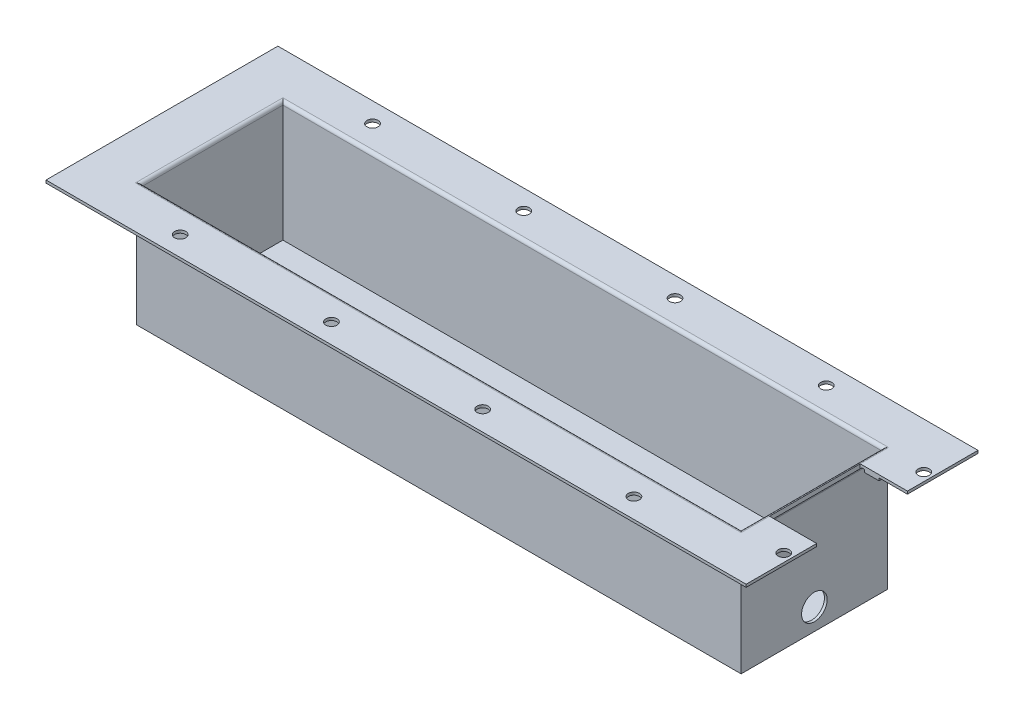
from build123d import *

# Parameters (mm, degrees)
SKETCH1_W               = 359.9
SKETCH1_H               = 87.2
BOSS_EXTRUDE1_DEPTH     = 1.6256
SKETCH2_W               = 359.9
SKETCH2_H               = 87.2
SKETCH2_W_2             = 356.6488
SKETCH2_H_2             = 83.9488
BOSS_EXTRUDE2_DEPTH     = 69.85
SKETCH3_W               = 416.6488
SKETCH3_H               = 138
SKETCH3_W_2             = 356.6488
SKETCH3_H_2             = 83.9488
BOSS_EXTRUDE3_DEPTH     = 1.6256
FILLET1_R               = 1.905
SKETCH6_W               = 371.0088
SKETCH6_H               = 92.8388
BOSS_EXTRUDE4_DEPTH     = 3.175
SKETCH8_R               = 7.62
CUT_EXTRUDE2_DEPTH      = 402.075797246
CUT_EXTRUDE4_DEPTH      = 232.308973187
CUT_EXTRUDE4_DEPTH_BACK = 232.308973187
SKETCH17_W              = 28.095
SKETCH17_H              = 54
CUT_EXTRUDE5_DEPTH      = 232.308973187
CUT_EXTRUDE5_DEPTH_BACK = 232.308973187
SKETCH18_R              = 3.325


with BuildPart() as part:
    # Sketch1 → Boss-Extrude1 (new body)
    with BuildSketch(Plane(origin=(0, 0, 0), x_dir=(1, 0, 0), z_dir=(0, 1, 0))):
        Rectangle(SKETCH1_W, SKETCH1_H)
    extrude(amount=BOSS_EXTRUDE1_DEPTH)

    # Sketch2 → Boss-Extrude2 (add)
    with BuildSketch(Plane(origin=(0, 1.6256, 0), x_dir=(1, 0, 0), z_dir=(0, 1, 0))):
        Rectangle(SKETCH2_W, SKETCH2_H)
        Rectangle(SKETCH2_W_2, SKETCH2_H_2, mode=Mode.SUBTRACT)
    extrude(amount=BOSS_EXTRUDE2_DEPTH)

    # Sketch3 → Boss-Extrude3 (add)
    with BuildSketch(Plane(origin=(0, 71.4756, 0), x_dir=(1, 0, 0), z_dir=(0, 1, 0))):
        Rectangle(SKETCH3_W, SKETCH3_H)
        Rectangle(SKETCH3_W_2, SKETCH3_H_2, mode=Mode.SUBTRACT)
    extrude(amount=BOSS_EXTRUDE3_DEPTH)

    # Fillet1
    fillet1_edges = [part.edges().sort_by_distance(p)[0] for p in [
        (0, 71.4756, 43.6),
        (179.95, 71.4756, 0),
        (0, 71.4756, -43.6),
        (-179.95, 71.4756, 0),
        (-178.3244, 73.1012, 0),
        (0, 73.1012, -41.9744),
        (178.3244, 73.1012, 0),
        (0, 73.1012, 41.9744),
    ]]
    fillet(fillet1_edges, radius=FILLET1_R)

    # Sketch6 → Boss-Extrude4 (add)
    with BuildSketch(Plane(origin=(0, 73.1012, 0), x_dir=(1, 0, 0), z_dir=(0, 1, 0))):
        Polygon((188.2394, -49.5944), (-188.2394, -49.5944), (-191.4144, -49.5944), (-191.4144, 49.5944), (-188.2394, 49.5944), (188.2394, 49.5944), (191.4144, 49.5944), (191.4144, -49.5944), align=None)
        with Locations((-2.735, 0)):
            Rectangle(SKETCH6_W, SKETCH6_H, mode=Mode.SUBTRACT)
    extrude(amount=-BOSS_EXTRUDE4_DEPTH)

    # Sketch8 → Cut-Extrude2 (cut, through all)
    with BuildSketch(Plane(origin=(179.95, 0, 0), x_dir=(0, 0, -1), z_dir=(1, 0, 0))):
        with Locations((0, 12.7)):
            Circle(SKETCH8_R)
    extrude(amount=-CUT_EXTRUDE2_DEPTH, mode=Mode.SUBTRACT)

    # Sketch17 → Cut-Extrude4 (cut, two sides: drawn at the far end of the back side and taken through both)
    with BuildSketch(Plane(origin=(0, 73.1012, 0), x_dir=(1, 0, 0), z_dir=(0, 1, 0)).offset(-CUT_EXTRUDE4_DEPTH_BACK)):
        with Locations((194.2769, 0)):
            Rectangle(SKETCH17_W, SKETCH17_H)
    extrude(amount=CUT_EXTRUDE4_DEPTH + CUT_EXTRUDE4_DEPTH_BACK, mode=Mode.SUBTRACT)

    # Sketch18 → Cut-Extrude5 (cut, two sides: drawn at the far end of the back side and taken through both)
    with BuildSketch(Plane(origin=(0, 73.1012, 0), x_dir=(1, 0, 0), z_dir=(0, 1, 0)).offset(-CUT_EXTRUDE5_DEPTH_BACK)):
        with Locations((203.37295269, 41.64816795)):
            Circle(SKETCH18_R)
        with Locations((203.37295269, -41.64816795)):
            Circle(SKETCH18_R)
        with Locations((129.76878637, 57.22406113)):
            Circle(SKETCH18_R)
        with Locations((-50.23121363, 57.22406113)):
            Circle(SKETCH18_R)
        with Locations((39.76878637, 57.22406113)):
            Circle(SKETCH18_R)
        with Locations((-140.23121363, 57.22406113)):
            Circle(SKETCH18_R)
        with Locations((129.76878637, -57.22406113)):
            Circle(SKETCH18_R)
        with Locations((39.76878637, -57.22406113)):
            Circle(SKETCH18_R)
        with Locations((-50.23121363, -57.22406113)):
            Circle(SKETCH18_R)
        with Locations((-140.23121363, -57.22406113)):
            Circle(SKETCH18_R)
    extrude(amount=CUT_EXTRUDE5_DEPTH + CUT_EXTRUDE5_DEPTH_BACK, mode=Mode.SUBTRACT)


solid = part.part
